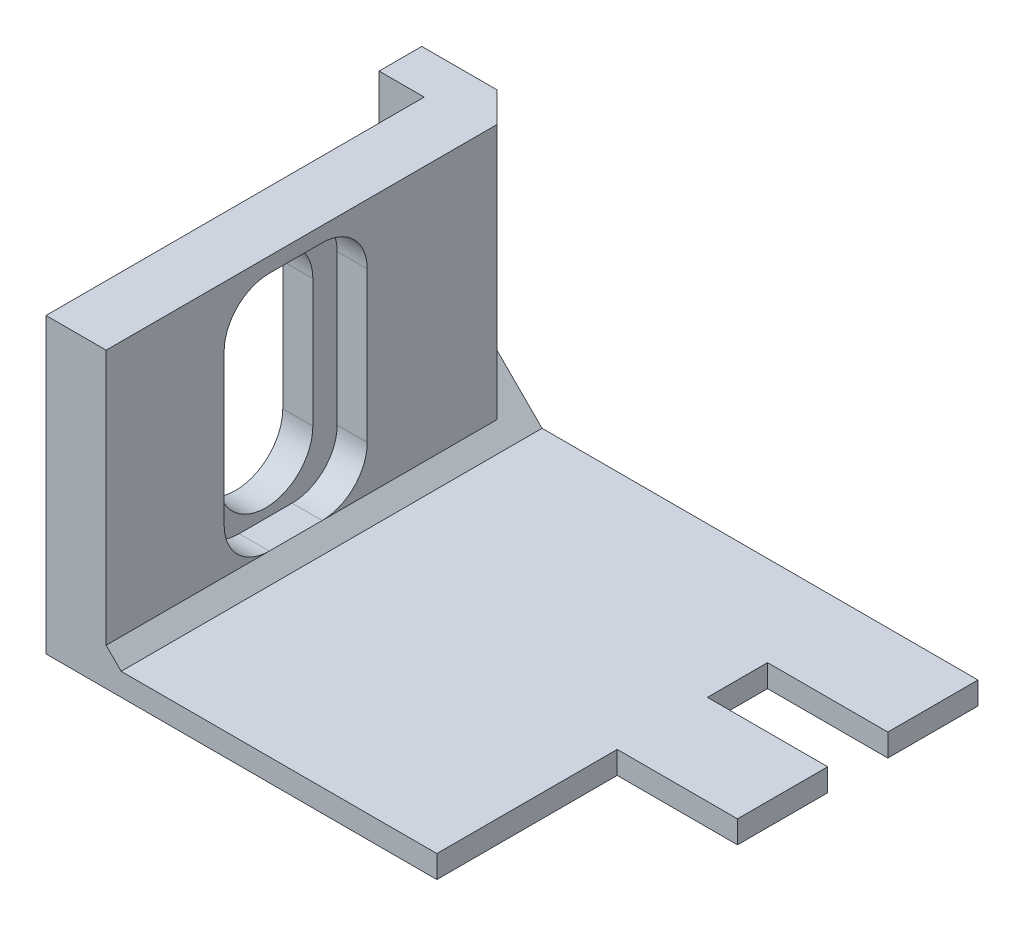
from build123d import *

# Parameters (mm, degrees)
BOSS_EXTRUDE1_DEPTH      = 1.5
BOSS_EXTRUDE2_DEPTH      = 18
BOSS_EXTRUDE2_DEPTH_BACK = 1
CUT_EXTRUDE2_DEPTH       = 2
CUT_EXTRUDE3_DEPTH       = 47.778734485
CHAMFER1_SIZE            = 1
CHAMFER2_SIZE            = 2


with BuildPart() as part:
    # Sketch1 → Boss-Extrude1 (new body)
    with BuildSketch(Plane(origin=(0, 0, 0), x_dir=(1, 0, 0), z_dir=(0, 1, 0))):
        Polygon((0, -2.84), (0, 0), (37, 0), (37, -6), (29, -6), (29, -10), (37, -10), (37, -16), (29, -16), (29, -28), (3, -28), (3, -2.84), align=None)
    extrude(amount=BOSS_EXTRUDE1_DEPTH)

    # Sketch2 → Boss-Extrude2 (add, two sides: drawn at the far end of the back side and taken through both)
    with BuildSketch(Plane(origin=(0, 1.5, 0), x_dir=(1, 0, 0), z_dir=(0, 1, 0)).offset(-BOSS_EXTRUDE2_DEPTH_BACK)):
        Polygon((7, 0), (0, 0), (0, -2.84), (3, -2.84), (3, -28), (7, -28), align=None)
    extrude(amount=BOSS_EXTRUDE2_DEPTH + BOSS_EXTRUDE2_DEPTH_BACK)

    # Sketch4 → Cut-Extrude2 (cut)
    with BuildSketch(Plane(origin=(7, 0, 0), x_dir=(0, 0, -1), z_dir=(1, 0, 0))):
        with BuildLine():
            Line((-17.15, 2.5), (-13.63, 2.5))
            ThreePointArc((-13.63, 2.5), (-11.508679656, 3.378679656), (-10.63, 5.5))
            Line((-10.63, 5.5), (-10.63, 15.5))
            ThreePointArc((-10.63, 15.5), (-11.508679656, 17.621320344), (-13.63, 18.5))
            Line((-13.63, 18.5), (-17.15, 18.5))
            ThreePointArc((-17.15, 18.5), (-19.271320344, 17.621320344), (-20.15, 15.5))
            Line((-20.15, 15.5), (-20.15, 5.5))
            ThreePointArc((-20.15, 5.5), (-19.271320344, 3.378679656), (-17.15, 2.5))
        make_face()
    extrude(amount=-CUT_EXTRUDE2_DEPTH, mode=Mode.SUBTRACT)

    # Sketch5 → Cut-Extrude3 (cut, through all)
    with BuildSketch(Plane(origin=(5, 0, 0), x_dir=(0, 0, -1), z_dir=(1, 0, 0))):
        with BuildLine():
            Line((-12.25, 14.75), (-12.25, 6.25))
            ThreePointArc((-12.25, 6.25), (-15.39, 3.11), (-18.53, 6.25))
            Line((-18.53, 6.25), (-18.53, 14.75))
            ThreePointArc((-18.53, 14.75), (-15.39, 17.89), (-12.25, 14.75))
        make_face()
    extrude(amount=-CUT_EXTRUDE3_DEPTH, mode=Mode.SUBTRACT)

    # Chamfer1
    chamfer1_edges = [part.edges().sort_by_distance(p)[0] for p in [
        (7, 1.5, 14),
    ]]
    chamfer(chamfer1_edges, length=CHAMFER1_SIZE - 0.0001)  # a hair under: the kernel refuses the full size

    # Chamfer2
    chamfer2_edges = [part.edges().sort_by_distance(p)[0] for p in [
        (7, 10.99995, 0),
    ]]
    chamfer(chamfer2_edges, length=CHAMFER2_SIZE)


solid = part.part
